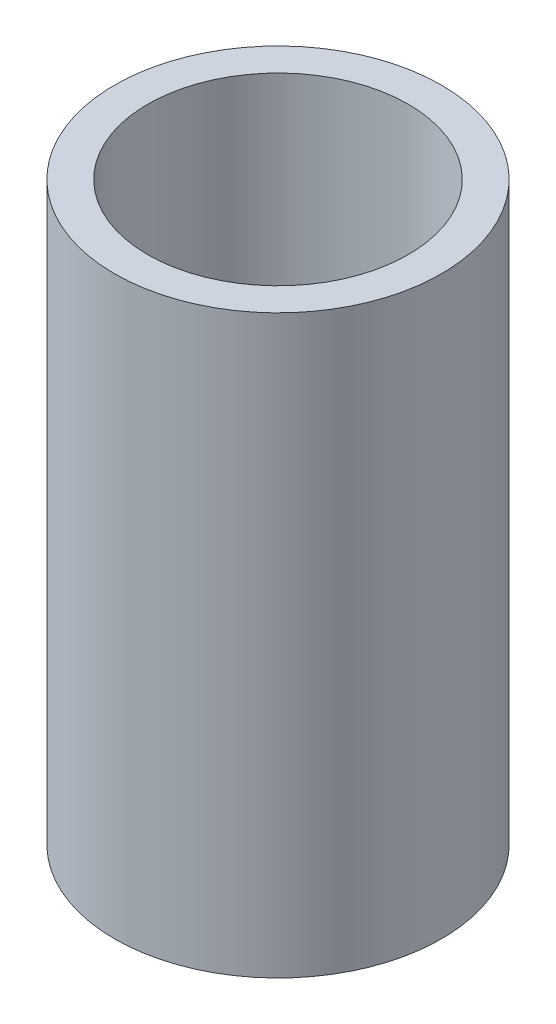
from build123d import *

# Parameters (mm, degrees)
SKETCH1_R           = 20
BOSS_EXTRUDE1_DEPTH = 70.490276382
SKETCH2_R           = 15.947581155
CUT_EXTRUDE1_DEPTH  = 76.953137291


with BuildPart() as part:
    # Sketch1 → Boss-Extrude1 (new body)
    with BuildSketch(Plane(origin=(0, 0, 0), x_dir=(1, 0, 0), z_dir=(0, 1, 0))):
        Circle(SKETCH1_R)
    extrude(amount=BOSS_EXTRUDE1_DEPTH)

    # Sketch2 → Cut-Extrude1 (cut, through all)
    with BuildSketch(Plane(origin=(0, 0, 0), x_dir=(1, 0, 0), z_dir=(0, 1, 0))):
        Circle(SKETCH2_R)
    extrude(amount=CUT_EXTRUDE1_DEPTH, mode=Mode.SUBTRACT)


solid = part.part
